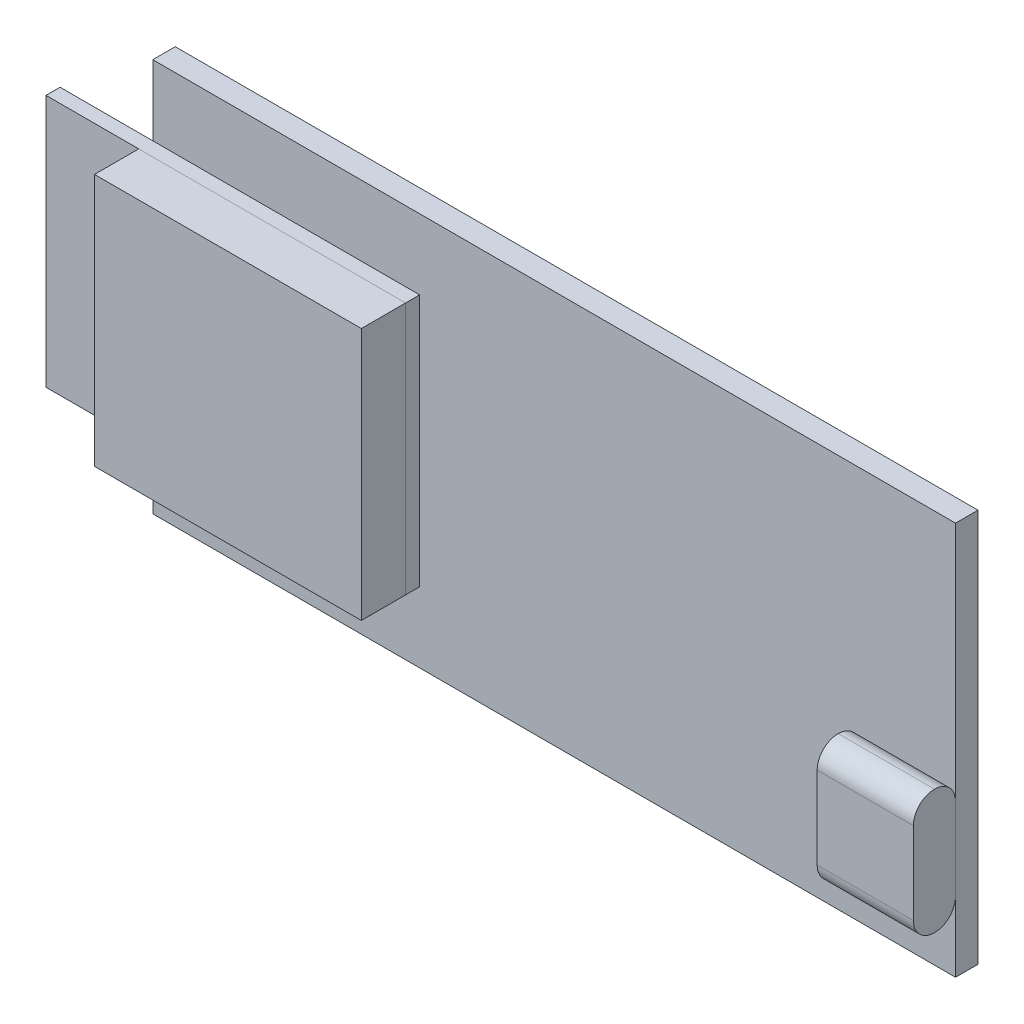
from build123d import *

# Parameters (mm, degrees)
SKETCH1_W           = 28
SKETCH1_H           = 57.15
BOSS_EXTRUDE1_DEPTH = 1.6
BOSS_EXTRUDE2_START = 1.6
SKETCH1_4_W         = 8.85
SKETCH1_4_H         = 6.85
BOSS_EXTRUDE2_DEPTH = 3
FILLET1_R           = 1.5
BOSS_EXTRUDE3_START = 1.6
SKETCH1_5_W         = 18
SKETCH1_5_H         = 6.6
SKETCH1_5_H_2       = 19
BOSS_EXTRUDE3_DEPTH = 1
BOSS_EXTRUDE4_START = 2.6
SKETCH1_6_W         = 18
SKETCH1_6_H         = 19
BOSS_EXTRUDE4_DEPTH = 3.15


with BuildPart() as part:
    # Sketch1 → Boss-Extrude1 (new body)
    with BuildSketch(Plane(origin=(0, 0, 0), x_dir=(0, 1, 0), z_dir=(0, 0, 1))):
        with Locations((916.997058045, 1178.438029113)):
            Rectangle(SKETCH1_W, SKETCH1_H)
    extrude(amount=BOSS_EXTRUDE1_DEPTH)


with BuildPart() as body_2:
    # Sketch1<4> → Boss-Extrude2 (new body)
    with BuildSketch(Plane(origin=(0, 0, 0), x_dir=(0, 1, 0), z_dir=(0, 0, 1)).offset(BOSS_EXTRUDE2_START)):
        with Locations((910.922058045, 1153.288029113)):
            Rectangle(SKETCH1_4_W, SKETCH1_4_H)
    extrude(amount=BOSS_EXTRUDE2_DEPTH)

    # Fillet1
    fillet1_edges = [body_2.edges().sort_by_distance(p)[0] for p in [
        (-1153.288029113, 906.497058045, 1.6),
        (-1153.288029113, 915.347058045, 1.6),
        (-1153.288029113, 915.347058045, 4.6),
        (-1153.288029113, 906.497058045, 4.6),
    ]]
    fillet(fillet1_edges, radius=FILLET1_R - 0.0001)  # a hair under: the kernel refuses the full size


with BuildPart() as body_3:
    # Sketch1<5> → Boss-Extrude3 (new body)
    with BuildSketch(Plane(origin=(0, 0, 0), x_dir=(0, 1, 0), z_dir=(0, 0, 1)).offset(BOSS_EXTRUDE3_START)):
        with Locations((916.997058045, 1210.313029113)):
            Rectangle(SKETCH1_5_W, SKETCH1_5_H)
        with Locations((916.997058045, 1197.513029113)):
            Rectangle(SKETCH1_5_W, SKETCH1_5_H_2)
    extrude(amount=BOSS_EXTRUDE3_DEPTH)


with BuildPart() as body_4:
    # Sketch1<6> → Boss-Extrude4 (new body)
    with BuildSketch(Plane(origin=(0, 0, 0), x_dir=(0, 1, 0), z_dir=(0, 0, 1)).offset(BOSS_EXTRUDE4_START)):
        with Locations((916.997058045, 1197.513029113)):
            Rectangle(SKETCH1_6_W, SKETCH1_6_H)
    extrude(amount=BOSS_EXTRUDE4_DEPTH)


solid = Compound([part.part, body_2.part, body_3.part, body_4.part])
